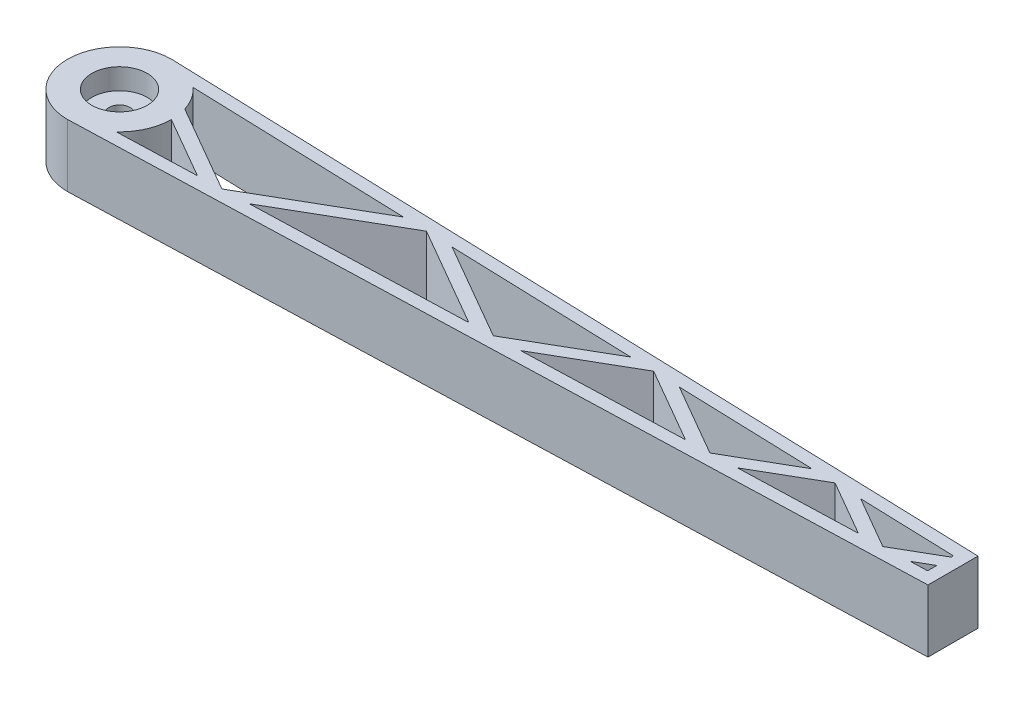
from build123d import *

# Parameters (mm, degrees)
SKETCH1_R           = 6.65
BOSS_EXTRUDE1_DEPTH = 15
BOSS_EXTRUDE2_START = -5
SKETCH2_R           = 6.65
SKETCH2_R_2         = 2.5
BOSS_EXTRUDE2_DEPTH = 5


with BuildPart() as part:
    # Sketch1 → Boss-Extrude1 (new body)
    with BuildSketch(Plane(origin=(0, 0, 0), x_dir=(1, 0, 0), z_dir=(0, 1, 0))):
        with BuildLine():
            Line((0, -12.5), (200, -6))
            Line((200, -6), (200, 6))
            Line((200, 6), (0, 12.5))
            ThreePointArc((0, 12.5), (-12.5, 0), (0, -12.5))
        make_face()
        with BuildLine():
            Line((27.305741081, -8.610979458), (8.435827248, -9.224251658))
            ThreePointArc((8.435827248, -9.224251658), (11.426226876, -5.068662485), (12.499842297, -0.06278981))
            Line((12.499842297, -0.06278981), (27.305741081, -8.610979458))
        make_face(mode=Mode.SUBTRACT)
        Polygon((90.383925047, -6.560938479), (39.343886955, -8.219739717), (66.300470013, 7.343650768), align=None, mode=Mode.SUBTRACT)
        Polygon((140.732488216, -4.924610176), (102.422070922, -6.169698738), (122.655557893, 5.512110412), align=None, mode=Mode.SUBTRACT)
        Polygon((180.92035752, -3.618504424), (152.770634091, -4.533370435), (167.637793012, 4.05018777), align=None, mode=Mode.SUBTRACT)
        Polygon((197, -3.095916043), (192.958503395, -3.227264683), (197, -0.89390553), align=None, mode=Mode.SUBTRACT)
        Circle(SKETCH1_R, mode=Mode.SUBTRACT)
        with BuildLine():
            ThreePointArc((11.930505504, 3.730018556), (10.54720469, 6.708686401), (8.435827248, 9.224251658))
            Line((8.435827248, 9.224251658), (60.62022063, 7.528258873))
            Line((60.62022063, 7.528258873), (32.985990463, -8.426371353))
            Line((32.985990463, -8.426371353), (11.930505504, 3.730018556))
        make_face(mode=Mode.SUBTRACT)
        Polygon((96.06417443, -6.376330374), (72.658366505, 7.137019132), (116.975308511, 5.696718517), align=None, mode=Mode.SUBTRACT)
        Polygon((146.412737599, -4.740002071), (129.013454385, 5.305478776), (161.957543629, 4.234795875), align=None, mode=Mode.SUBTRACT)
        Polygon((173.995689504, 3.843556134), (197, 3.095916043), (197, 2.570196085), (186.600606903, -3.433896319), align=None, mode=Mode.SUBTRACT)
    extrude(amount=BOSS_EXTRUDE1_DEPTH)

    # Sketch2 → Boss-Extrude2 (add)
    with BuildSketch(Plane(origin=(0, 10, 0), x_dir=(1, 0, 0), z_dir=(0, 1, 0)).offset(BOSS_EXTRUDE2_START)):
        Circle(SKETCH2_R)
        Circle(SKETCH2_R_2, mode=Mode.SUBTRACT)
    extrude(amount=BOSS_EXTRUDE2_DEPTH)


solid = part.part
